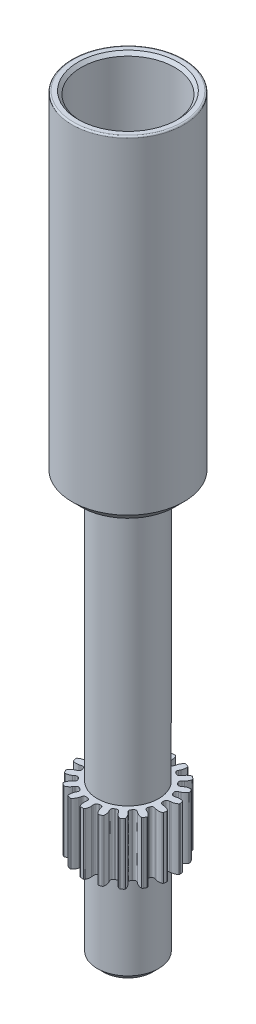
from build123d import *

# Parameters (mm, degrees)
CHAMFER1_SIZE       = 3
FILLET1_R           = 0.5
CHAMFER2_SIZE       = 1
BOSS_EXTRUDE1_START = -20
BOSS_EXTRUDE1_DEPTH = 20
CIRPATTERN2_COUNT   = 18
CHAMFER3_SIZE       = 2


with BuildPart() as part:
    # Sketch1 → Revolve1 (revolve)
    with BuildSketch(Plane.XY):
        Polygon((0, 0), (-10, 0), (-10, 135), (-18.25, 135), (-18.25, 245), (-15.25, 245), (-15.25, 155), (0, 155), align=None)
    revolve(axis=Axis((0, 155, 0), (0, -1, 0)))

    # Chamfer1
    chamfer1_edges = [part.edges().sort_by_distance(p)[0] for p in [
        (18.25, 135, 0),
    ]]
    chamfer(chamfer1_edges, length=CHAMFER1_SIZE)

    # Fillet1
    fillet1_edges = [part.edges().sort_by_distance(p)[0] for p in [
        (18.25, 245, 0),
    ]]
    fillet(fillet1_edges, radius=FILLET1_R)

    # Chamfer2
    chamfer2_edges = [part.edges().sort_by_distance(p)[0] for p in [
        (15.25, 245, 0),
    ]]
    chamfer(chamfer2_edges, length=CHAMFER2_SIZE)

    # Boss-Extrude1: read off the stored shape, not the designer's step
    # Boss-Extrude1 outline → Boss-Extrude1 (add)
    with BuildSketch(Plane(origin=(0, 30, 0), x_dir=(-1, 0, 0), z_dir=(0, -1, 0)).offset(BOSS_EXTRUDE1_START)):
        with BuildLine():
            Line((1.736481777, 9.84807753), (1.996954043, 11.32528916))
            ThreePointArc((1.996954043, 11.32528916), (1.501051211, 11.401615906), (1.002291042, 11.456239028))
            Line((1.002291042, 11.456239028), (1.133024656, 12.950531075))
            ThreePointArc((1.133024656, 12.950531075), (1.082214813, 13.890001053), (0.771450679, 14.778038852))
            ThreePointArc((0.771450679, 14.778038852), (0.628979594, 14.932818936), (0.427674465, 14.993901912))
            ThreePointArc((0.427674465, 14.993901912), (0, 15), (-0.427674465, 14.993901912))
            ThreePointArc((-0.427674465, 14.993901912), (-0.628979594, 14.932818936), (-0.771450679, 14.778038852))
            ThreePointArc((-0.771450679, 14.778038852), (-1.082214813, 13.890001053), (-1.133024656, 12.950531075))
            Line((-1.133024656, 12.950531075), (-1.002291042, 11.456239028))
            ThreePointArc((-1.002291042, 11.456239028), (-1.501051211, 11.401615906), (-1.996954043, 11.32528916))
            Line((-1.996954043, 11.32528916), (-1.736481777, 9.84807753))
            ThreePointArc((-1.736481777, 9.84807753), (0, 10), (1.736481777, 9.84807753))
        make_face()
    boss_extrude1 = extrude(amount=BOSS_EXTRUDE1_DEPTH)

    # Fillet2
    # a fillet whose section is not a circle: 1 mm, written as the material it adds along each edge
    with BuildSketch(Plane(origin=(1.002291042, 50, -11.456239028), x_dir=(0.08715574267524777, 0, -0.9961946980980806), z_dir=(0, -1, 0))) as fillet2_piece_1:
        with BuildLine():
            add(Edge.make_bspline([(0.959935795, 0), (0.80275088, 0), (0.645565966, 0), (0.29793182, 0.062940487), (0.078840004, 0.265153077), (-0.011709483, 0.606637769), (-0.024284276, 0.763318885), (-0.036859069, 0.92)], knots=[0, 0, 0, 0, 0, 0, 0.5, 0.5, 1, 1, 1, 1, 1, 1], degree=5))
            ThreePointArc((-0.036859069, 0.92), (-0.009218462, 0.460369034), (0, 0))
            Line((0, 0), (0.959935795, 0))
        make_face()
    extrude(amount=20)
    with BuildSketch(Plane(origin=(-1.002291042, 50, -11.456239028), x_dir=(-0.9919071165561713, 0, 0.12696563363848473), z_dir=(0, -1, 0))) as fillet2_piece_2:
        with BuildLine():
            add(Edge.make_bspline([(0.920738068, 0), (0.763679154, 0.006292441), (0.60662024, 0.012584881), (0.261784399, 0.089391437), (0.050963201, 0.300212635), (-0.025843355, 0.645048477), (-0.032135795, 0.802107391), (-0.038428236, 0.959166305)], knots=[0, 0, 0, 0, 0, 0, 0.5, 0.5, 1, 1, 1, 1, 1, 1], degree=5))
            Line((-0.038428236, 0.959166305), (0, 0))
            ThreePointArc((0, 0), (0.460369034, 0.009218462), (0.920738068, 0))
        make_face()
    extrude(amount=20)

    # CirPattern2: Boss-Extrude1 ×18 about axis
    cirpattern2_axis = Axis((0, 155, 0), (0, 1, 0))
    for i in range(1, CIRPATTERN2_COUNT):
        add(boss_extrude1.rotate(cirpattern2_axis, i * 360 / CIRPATTERN2_COUNT))

    # Fillet2 of CirPattern2
    # a fillet whose section is not a circle: 1 mm, written as the material it adds along each edge
    with BuildSketch(Plane(origin=(-2.976419018, 50, -11.108147002), x_dir=(0.9755126021473315, 0, -0.21994354514679937), z_dir=(0, -1, 0))) as fillet2_of_cirpattern2_piece_1:
        with BuildLine():
            add(Edge.make_bspline([(0.920738068, 0), (0.763679154, -0.006292441), (0.60662024, -0.012584881), (0.261784399, -0.089391437), (0.050963201, -0.300212635), (-0.025843355, -0.645048477), (-0.032135795, -0.802107391), (-0.038428236, -0.959166305)], knots=[0, 0, 0, 0, 0, 0, 0.5, 0.5, 1, 1, 1, 1, 1, 1], degree=5))
            Line((-0.038428236, -0.959166305), (0, 0))
            ThreePointArc((0, 0), (0.460369034, -0.009218462), (0.920738068, 0))
        make_face()
    extrude(amount=20)
    with BuildSketch(Plane(origin=(-4.86011001, 50, -10.422539551), x_dir=(-0.8886629937183937, 0, 0.45856088319378274), z_dir=(0, -1, 0)), Plane(origin=(-8.131727984, 50, -8.131727983), x_dir=(-0.6782329985692063, 0, 0.734846922598049), z_dir=(0, -1, 0)), Plane(origin=(-10.422539551, 50, -4.86011001), x_dir=(-0.38599809413956854, 0, 0.9224995779514595), z_dir=(0, -1, 0)), Plane(origin=(-11.456239028, 50, -1.002291041), x_dir=(-0.04720612283154897, 0, 0.9988851695601515), z_dir=(0, -1, 0)), Plane(origin=(-11.108147002, 50, 2.976419019), x_dir=(0.29727960357812483, 0, 0.9547904677448518), z_dir=(0, -1, 0)), Plane(origin=(-9.420248509, 50, 6.596129018), x_dir=(0.6059090224166004, 0, 0.795533944312975), z_dir=(0, -1, 0)), Plane(origin=(-6.596129018, 50, 9.42024851), x_dir=(0.8414568708868413, 0, 0.5403242863663686), z_dir=(0, -1, 0)), Plane(origin=(-2.976419018, 50, 11.108147002), x_dir=(0.9755126021473308, 0, 0.21994354514680234), z_dir=(0, -1, 0)), Plane(origin=(1.002291042, 50, 11.456239028), x_dir=(0.9919071165561714, 0, -0.12696563363848473), z_dir=(0, -1, 0)), Plane(origin=(4.86011001, 50, 10.422539551), x_dir=(0.888662993718394, 0, -0.4585608831937824), z_dir=(0, -1, 0)), Plane(origin=(8.131727984, 50, 8.131727983), x_dir=(0.6782329985692073, 0, -0.7348469225980481), z_dir=(0, -1, 0)), Plane(origin=(10.422539551, 50, 4.86011001), x_dir=(0.3859980941395722, 0, -0.922499577951458), z_dir=(0, -1, 0)), Plane(origin=(11.456239028, 50, 1.002291041), x_dir=(0.047206122831550915, 0, -0.9988851695601514), z_dir=(0, -1, 0)), Plane(origin=(11.108147002, 50, -2.976419019), x_dir=(-0.2972796035781262, 0, -0.9547904677448513), z_dir=(0, -1, 0)), Plane(origin=(9.420248509, 50, -6.596129018), x_dir=(-0.605909022416602, 0, -0.7955339443129738), z_dir=(0, -1, 0)), Plane(origin=(6.596129018, 50, -9.42024851), x_dir=(-0.8414568708868405, 0, -0.5403242863663701), z_dir=(0, -1, 0)), Plane(origin=(2.976419018, 50, -11.108147002), x_dir=(-0.9755126021473312, 0, -0.2199435451468006), z_dir=(0, -1, 0))) as fillet2_of_cirpattern2_piece_2:
        with BuildLine():
            add(Edge.make_bspline([(0.920738068, 0), (0.763679154, 0.006292441), (0.60662024, 0.012584881), (0.261784399, 0.089391437), (0.050963201, 0.300212635), (-0.025843355, 0.645048477), (-0.032135795, 0.802107391), (-0.038428236, 0.959166305)], knots=[0, 0, 0, 0, 0, 0, 0.5, 0.5, 1, 1, 1, 1, 1, 1], degree=5))
            Line((-0.038428236, 0.959166305), (0, 0))
            ThreePointArc((0, 0), (0.460369034, 0.009218462), (0.920738068, 0))
        make_face()
    extrude(amount=20)
    with BuildSketch(Plane(origin=(-6.596129018, 50, -9.42024851), x_dir=(-0.5735764364105885, 0, -0.8191520442472998), z_dir=(0, -1, 0)), Plane(origin=(-9.420248509, 50, -6.596129018), x_dir=(-0.819152044330683, 0, -0.573576436291505), z_dir=(0, -1, 0)), Plane(origin=(-11.108147002, 50, -2.976419019), x_dir=(-0.9659258263078813, 0, -0.2588190450323101), z_dir=(0, -1, 0)), Plane(origin=(-11.456239028, 50, 1.002291041), x_dir=(-0.9961946980854105, 0, 0.08715574282006819), z_dir=(0, -1, 0)), Plane(origin=(-10.422539551, 50, 4.86011001), x_dir=(-0.9063077870059316, 0, 0.42261826180657514), z_dir=(0, -1, 0)), Plane(origin=(-8.131727984, 50, 8.131727983), x_dir=(-0.7071067811351491, 0, 0.707106781237946), z_dir=(0, -1, 0)), Plane(origin=(-4.86011001, 50, 10.422539551), x_dir=(-0.4226182616748229, 0, 0.9063077870673687), z_dir=(0, -1, 0)), Plane(origin=(-1.002291042, 50, 11.456239028), x_dir=(-0.08715574267524784, 0, 0.9961946980980806), z_dir=(0, -1, 0)), Plane(origin=(2.976419018, 50, 11.108147002), x_dir=(0.2588190451727309, 0, 0.9659258262702556), z_dir=(0, -1, 0)), Plane(origin=(6.596129018, 50, 9.42024851), x_dir=(0.5735764364105882, 0, 0.8191520442472999), z_dir=(0, -1, 0)), Plane(origin=(9.420248509, 50, 6.596129018), x_dir=(0.8191520443306841, 0, 0.5735764362915035), z_dir=(0, -1, 0)), Plane(origin=(11.108147002, 50, 2.976419019), x_dir=(0.9659258263078809, 0, 0.2588190450323109), z_dir=(0, -1, 0)), Plane(origin=(11.456239028, 50, -1.002291041), x_dir=(0.9961946980854104, 0, -0.08715574282006816), z_dir=(0, -1, 0)), Plane(origin=(10.422539551, 50, -4.86011001), x_dir=(0.9063077870059312, 0, -0.42261826180657586), z_dir=(0, -1, 0)), Plane(origin=(8.131727984, 50, -8.131727983), x_dir=(0.70710678113515, 0, -0.7071067812379451), z_dir=(0, -1, 0)), Plane(origin=(4.86011001, 50, -10.422539551), x_dir=(0.42261826167482297, 0, -0.9063077870673687), z_dir=(0, -1, 0))) as fillet2_of_cirpattern2_piece_3:
        with BuildLine():
            add(Edge.make_bspline([(0.959935795, 0), (0.80275088, 0), (0.645565966, 0), (0.29793182, 0.062940487), (0.078840004, 0.265153077), (-0.011709483, 0.606637769), (-0.024284276, 0.763318885), (-0.036859069, 0.92)], knots=[0, 0, 0, 0, 0, 0, 0.5, 0.5, 1, 1, 1, 1, 1, 1], degree=5))
            ThreePointArc((-0.036859069, 0.92), (-0.009218462, 0.460369034), (0, 0))
            Line((0, 0), (0.959935795, 0))
        make_face()
    extrude(amount=20)

    # Chamfer3
    chamfer3_edges = [part.edges().sort_by_distance(p)[0] for p in [
        (10, 0, 0),
    ]]
    chamfer(chamfer3_edges, length=CHAMFER3_SIZE)


solid = part.part
